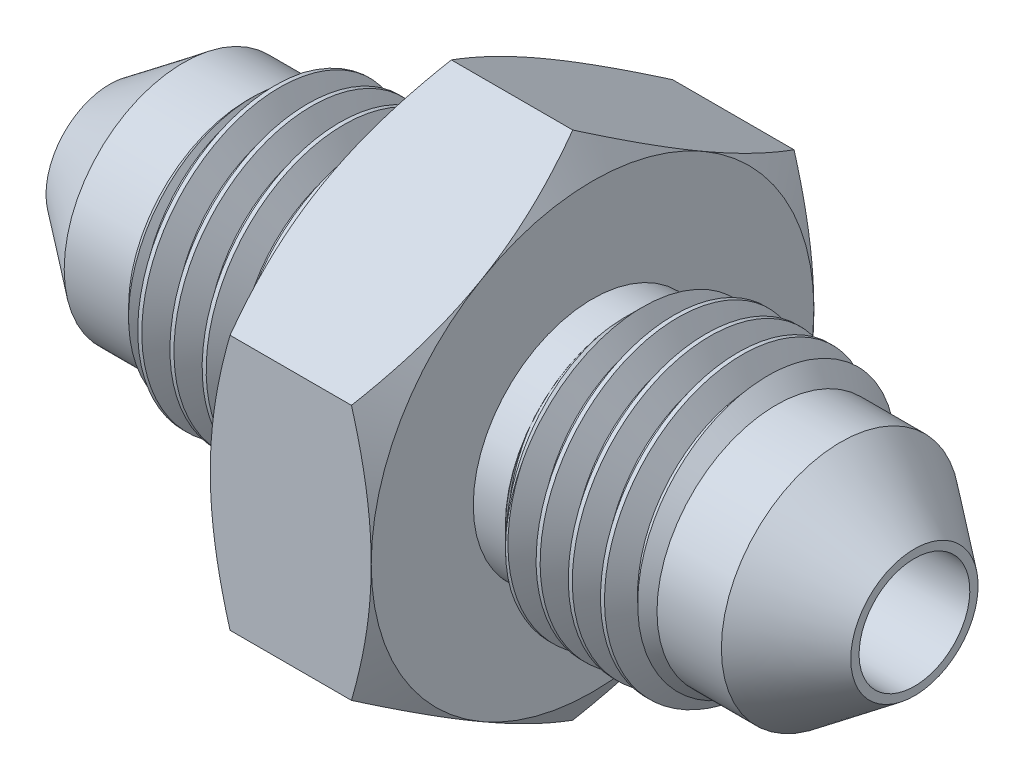
from build123d import *

# Parameters (mm, degrees)
SKETCH6_W         = 31.75
SKETCH6_H         = 5.55625
CUT_SWEEP1_PITCH  = 1.27
CIRPATTERN1_COUNT = 2
EXTRUDE1_DEPTH    = 6.35
SKETCH7_W         = 31.75
SKETCH7_H         = 2.1844


with BuildPart() as part:
    # Sketch6 → Revolve3 (revolve)
    with BuildSketch(Plane.XY, mode=Mode.PRIVATE) as revolve3_sk:
        with Locations((0, 2.778125)):
            Rectangle(SKETCH6_W, SKETCH6_H)
    revolve(revolve3_sk.sketch.rotate(Axis((-15.875, 0, 0), (1, 0, 0)), 90), axis=Axis((-15.875, 0, 0), (1, 0, 0)))

    # Cut-Sweep1: the profile of Sketch15 profile screwed along a right-hand helix of 11 turns, 8 arcs to a turn; built about Z, then put on its axis
    cut_sweep1_z = Axis((0, 0, 0), (0, 0, 1))
    cut_sweep1_corners = [(5.55655, 0, -1.111423205), (5.55655, 0, 0.000173205), (4.731360803, 0, -0.47625), (4.731360803, 0, -0.635)]
    with BuildLine(mode=Mode.PRIVATE) as cut_sweep1_profile:
        Line(cut_sweep1_corners[0], cut_sweep1_corners[1])
        Line(cut_sweep1_corners[1], cut_sweep1_corners[2])
        Line(cut_sweep1_corners[2], cut_sweep1_corners[3])
        Line(cut_sweep1_corners[3], cut_sweep1_corners[0])
    cut_sweep1_cap = Face(cut_sweep1_profile.wire())
    cut_sweep1_turn_angles = [0, 22.5, 45, 67.5, 90, 112.5, 135, 157.5, 180, 202.5, 225, 247.5, 270, 292.5, 315, 337.5, 360]
    cut_sweep1_turn_weights = [1, 0.9238795325112867, 1, 0.9238795325112867, 1, 0.9238795325112867, 1, 0.9238795325112867, 1, 0.9238795325112867, 1, 0.9238795325112867, 1, 0.9238795325112867, 1, 0.9238795325112867, 1]
    cut_sweep1_turn_rails = [Edge.make_bspline([Vector(p[0], p[1], 0).rotate(cut_sweep1_z, cut_sweep1_turn_angles[k]) / cut_sweep1_turn_weights[k] + Vector(0, 0, p[2] + CUT_SWEEP1_PITCH * cut_sweep1_turn_angles[k] / 360) for k in range(17)], [0, 0, 0, 1, 1, 2, 2, 3, 3, 4, 4, 5, 5, 6, 6, 7, 7, 8, 8, 8], 2, cut_sweep1_turn_weights) for p in cut_sweep1_corners]
    cut_sweep1_turn_sides = [Face.make_surface_from_curves(cut_sweep1_turn_rails[p[0]], cut_sweep1_turn_rails[p[1]]) for p in [(0, 1), (1, 2), (2, 3), (3, 0)]]
    cut_sweep1 = Plane(origin=(-15.875, 0, 0), x_dir=(0, 1, 0), z_dir=(1, 0, 0)) * Solid(Shell([*[p.moved(Location((0, 0, CUT_SWEEP1_PITCH * i))) for i in range(11) for p in cut_sweep1_turn_sides], cut_sweep1_cap, cut_sweep1_cap.rotate(cut_sweep1_z, 3960).moved(Location((0, 0, CUT_SWEEP1_PITCH * 3960 / 360)))]))
    add(cut_sweep1, mode=Mode.SUBTRACT)

    # CirPattern1: Cut-Sweep1 ×2 about axis
    cirpattern1_axis = Axis((0, 0, 5.55625), (0, 0, -1))
    for i in range(1, CIRPATTERN1_COUNT):
        add(cut_sweep1.rotate(cirpattern1_axis, i * 360 / CIRPATTERN1_COUNT), mode=Mode.SUBTRACT)

    # Sketch12 → Extrude1 (add)
    with BuildSketch(Plane(origin=(-3.175, 0, 0), x_dir=(0, 0, -1), z_dir=(1, 0, 0))):
        Polygon((0, 10.081979076), (-8.73125, 5.040989538), (-8.73125, -5.040989538), (0, -10.081979076), (8.73125, -5.040989538), (8.73125, 5.040989538), align=None)
    extrude(amount=EXTRUDE1_DEPTH)

    # Sketch10 → Cut-Revolve6 (revolve, cut)
    with BuildSketch(Plane.XY, mode=Mode.PRIVATE) as cut_revolve6_sk:
        Polygon((-5.295289197, 5.55625), (-4.445, 4.705960803), (-3.175, 4.705960803), (-3.175, 5.55625), align=None)
        Polygon((5.295289197, 5.55625), (3.175, 5.55625), (3.175, 4.705960803), (4.445, 4.705960803), align=None)
        Polygon((-15.875, 2.51206), (-15.875, 5.55625), (-9.573306103, 5.55625), (-10.4235953, 4.705960803), (-12.9635953, 4.705960803), align=None)
        Polygon((15.875, 5.55625), (9.573306103, 5.55625), (10.4235953, 4.705960803), (12.9635953, 4.705960803), (15.875, 2.51206), align=None)
    revolve(cut_revolve6_sk.sketch.rotate(Axis((-15.875, 0, 0), (1, 0, 0)), 90), axis=Axis((-15.875, 0, 0), (1, 0, 0)), mode=Mode.SUBTRACT)

    # Sketch7 → Cut-Revolve5 (revolve, cut)
    with BuildSketch(Plane.XY, mode=Mode.PRIVATE) as cut_revolve5_sk:
        with Locations((0, 1.0922)):
            Rectangle(SKETCH7_W, SKETCH7_H)
    revolve(cut_revolve5_sk.sketch.rotate(Axis((15.875, 0, 0), (-1, 0, 0)), 352.583397479), axis=Axis((15.875, 0, 0), (-1, 0, 0)), mode=Mode.SUBTRACT)

    # Sketch13 → Cut-Revolve7 (revolve, cut)
    with BuildSketch(Plane.XY, mode=Mode.PRIVATE) as cut_revolve7_sk:
        Polygon((-3.175, 10.081979076), (-3.175, 8.73125), (-2.395156205, 10.081979076), align=None)
        Polygon((2.395156205, 10.081979076), (3.175, 8.73125), (3.175, 10.081979076), align=None)
    revolve(cut_revolve7_sk.sketch.rotate(Axis((-15.875, 0, 0), (1, 0, 0)), 7.416602521), axis=Axis((-15.875, 0, 0), (1, 0, 0)), mode=Mode.SUBTRACT)


solid = part.part
